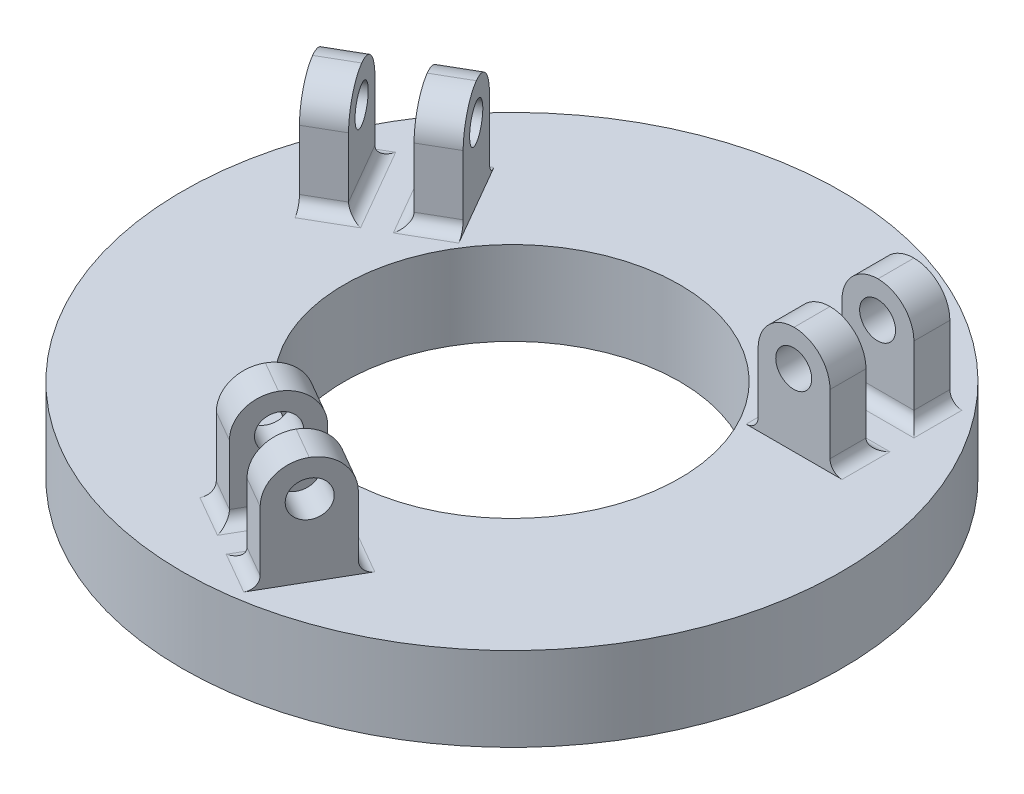
from build123d import *

# Parameters (mm, degrees)
SKETCH1_R                = 27.5
SKETCH1_R_2              = 14
BOSS_EXTRUDE1_DEPTH      = 7
SKETCH3_W                = 6
SKETCH3_H                = 3
BOSS_EXTRUDE2_DEPTH      = 9
FILLET1_R                = 3
FILLET2_R                = 1
SKETCH5_R                = 1.5
CUT_EXTRUDE2_DEPTH       = 47.703277471
CIRPATTERN2_COUNT        = 3
FILLET1_OF_CIRPATTERN2_R = 3
FILLET2_OF_CIRPATTERN2_R = 1


with BuildPart() as part:
    # Sketch1 → Boss-Extrude1 (new body)
    with BuildSketch(Plane(origin=(0, 0, 0), x_dir=(1, 0, 0), z_dir=(0, 1, 0))):
        with Locations(Location((0, 0, 0), (0, 0, 270))):
            Circle(SKETCH1_R)
        with Locations(Location((0, 0, 0), (0, 0, 270))):
            Circle(SKETCH1_R_2, mode=Mode.SUBTRACT)
    extrude(amount=BOSS_EXTRUDE1_DEPTH)

    # Sketch3 → Boss-Extrude2 (add)
    with BuildSketch(Plane(origin=(0, 7, 0), x_dir=(1, 0, 0), z_dir=(0, 1, 0))):
        with Locations((16.852148123, 8.189854147)):
            Rectangle(SKETCH3_W, SKETCH3_H)
        with Locations((16.852148123, 15.189854147)):
            Rectangle(SKETCH3_W, SKETCH3_H)
    boss_extrude2 = extrude(amount=BOSS_EXTRUDE2_DEPTH)

    # Fillet1
    fillet1_edges = [part.edges().sort_by_distance(p)[0] for p in [
        (19.852148123, 16, -8.189854147),
        (13.852148123, 16, -8.189854147),
        (13.852148123, 16, -15.189854147),
        (19.852148123, 16, -15.189854147),
    ]]
    fillet(fillet1_edges, radius=FILLET1_R - 0.0001)  # a hair under: the kernel refuses the full size

    # Fillet2
    fillet2_edges = [part.edges().sort_by_distance(p)[0] for p in [
        (19.852148123, 7, -8.189854147),
        (16.852148123, 7, -9.689854147),
        (13.852148123, 7, -8.189854147),
        (19.852148123, 7, -15.189854147),
        (13.852148123, 7, -15.189854147),
        (16.852148123, 7, -13.689854147),
    ]]
    fillet(fillet2_edges, radius=FILLET2_R)

    # Sketch5 → Cut-Extrude2 (cut, symmetric)
    with BuildSketch(Plane.XY.offset(-6.689854147)):
        with Locations((16.823138997, 13)):
            Circle(SKETCH5_R)
    cut_extrude2 = extrude(amount=CUT_EXTRUDE2_DEPTH, both=True, mode=Mode.SUBTRACT)

    # CirPattern2: Boss-Extrude2, Cut-Extrude2 ×3 about axis
    cirpattern2_axis = Axis((0, 0, 0), (0, 1, 0))
    add([boss_extrude2.rotate(cirpattern2_axis, i * 360 / CIRPATTERN2_COUNT) for i in range(1, CIRPATTERN2_COUNT)])
    add([cut_extrude2.rotate(cirpattern2_axis, i * 360 / CIRPATTERN2_COUNT) for i in range(1, CIRPATTERN2_COUNT)], mode=Mode.SUBTRACT)

    # Fillet1 of CirPattern2
    fillet1_of_cirpattern2_edges = [part.edges().sort_by_distance(p)[0] for p in [
        (-17.018695806, 16, -13.097537521),
        (-14.018695806, 16, -7.901385098),
        (-20.080873632, 16, -4.401385098),
        (-23.080873632, 16, -9.597537521),
        (-2.833452317, 16, 21.287391668),
        (0.166547683, 16, 16.091239245),
        (6.228725509, 16, 19.591239245),
        (3.228725509, 16, 24.787391668),
    ]]
    fillet(fillet1_of_cirpattern2_edges, radius=FILLET1_OF_CIRPATTERN2_R - 0.0001)  # a hair under: the kernel refuses the full size

    # Fillet2 of CirPattern2
    fillet2_of_cirpattern2_edges = [part.edges().sort_by_distance(p)[0] for p in [
        (-17.018695806, 7, -13.097537521),
        (-16.817733912, 7, -9.749461309),
        (-14.018695806, 7, -7.901385098),
        (-23.080873632, 7, -9.597537521),
        (-20.080873632, 7, -4.401385098),
        (-20.281835527, 7, -7.749461309),
        (-2.833452317, 7, 21.287391668),
        (-0.034414211, 7, 19.439315456),
        (0.166547683, 7, 16.091239245),
        (3.228725509, 7, 24.787391668),
        (6.228725509, 7, 19.591239245),
        (3.429687404, 7, 21.439315456),
    ]]
    fillet(fillet2_of_cirpattern2_edges, radius=FILLET2_OF_CIRPATTERN2_R)


solid = part.part
